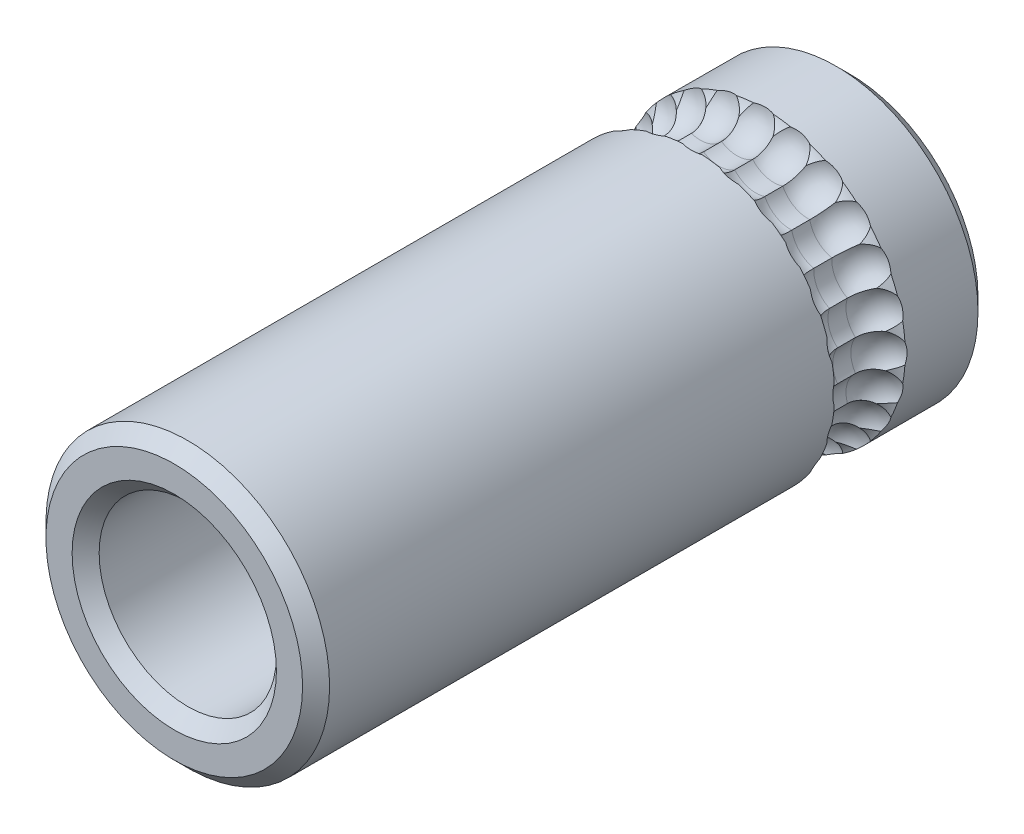
from build123d import *

# Parameters (mm, degrees)
SKETCH1_R           = 4
SKETCH1_R_2         = 2.5
BOSS_EXTRUDE1_DEPTH = 19.05
CIRPATTERN1_COUNT   = 24
CHAMFER1_SIZE       = 0.381
CUT_EXTRUDE1_REACH  = 21.872
SKETCH5_R           = 1.397


with BuildPart() as part:
    # Sketch1 → Boss-Extrude1 (new body)
    with BuildSketch(Plane.XY):
        Circle(SKETCH1_R)
        Circle(SKETCH1_R_2, mode=Mode.SUBTRACT)
    extrude(amount=BOSS_EXTRUDE1_DEPTH)

    # Sketch3 → Cut-Revolve2 (revolve, cut)
    with BuildSketch(Plane(origin=(0, 0, 0), x_dir=(1, 0, 0), z_dir=(0, 1, 0))):
        with BuildLine():
            Line((3.20625, -3.175), (3.20625, -3.683))
            ThreePointArc((3.20625, -3.683), (3.438733992, -4.244266008), (4, -4.47675))
            Line((4, -4.47675), (4, -2.38125))
            ThreePointArc((4, -2.38125), (3.438733992, -2.613733992), (3.20625, -3.175))
        make_face()
    cut_revolve2 = revolve(axis=Axis((4, 0, 3.175), (0, 0, 1)), mode=Mode.SUBTRACT)

    # CirPattern1: Cut-Revolve2 ×24 about axis
    cirpattern1_axis = Axis((0, 0, 19.05), (0, 0, -1))
    for i in range(1, CIRPATTERN1_COUNT):
        add(cut_revolve2.rotate(cirpattern1_axis, i * 360 / CIRPATTERN1_COUNT), mode=Mode.SUBTRACT)

    # Sketch4 → Cut-Revolve3 (revolve, cut)
    with BuildSketch(Plane(origin=(0, 0, 0), x_dir=(1, 0, 0), z_dir=(0, 1, 0))):
        with BuildLine():
            Line((5.07315, -3.175), (5.07315, -3.683))
            ThreePointArc((5.07315, -3.683), (4.2794, -4.47675), (3.48565, -3.683))
            Line((3.48565, -3.683), (3.48565, -3.175))
            ThreePointArc((3.48565, -3.175), (4.2794, -2.38125), (5.07315, -3.175))
        make_face()
    revolve(axis=Axis((0, 0, 19.05), (0, 0, -1)), mode=Mode.SUBTRACT)

    # Chamfer1
    chamfer1_edges = [part.edges().sort_by_distance(p)[0] for p in [
        (-4, 0, 0),
        (-4, 0, 19.05),
        (-2.5, 0, 19.05),
        (-2.5, 0, 0),
    ]]
    chamfer(chamfer1_edges, length=CHAMFER1_SIZE)

    # Sketch5 → Cut-Extrude1 (cut, up to next)
    with BuildSketch(Plane(origin=(0, 0, 0), x_dir=(1, 0, 0), z_dir=(0, 1, 0)), mode=Mode.PRIVATE) as cut_extrude1_sk1:
        with Locations((0, -9.525)):
            Circle(SKETCH5_R)
    cut_extrude1_tool1 = extrude(cut_extrude1_sk1.sketch, amount=-CUT_EXTRUDE1_REACH, mode=Mode.PRIVATE) & part.part
    # Sketch5 → Cut-Extrude1 (cut, up to next)
    with BuildSketch(Plane(origin=(0, 0, 0), x_dir=(1, 0, 0), z_dir=(0, 1, 0)), mode=Mode.PRIVATE) as cut_extrude1_sk2:
        with Locations((0, -14.2875)):
            Circle(SKETCH5_R)
    cut_extrude1_tool2 = extrude(cut_extrude1_sk2.sketch, amount=-CUT_EXTRUDE1_REACH, mode=Mode.PRIVATE) & part.part
    add(cut_extrude1_tool1.solids().sort_by_distance((0, 0, 9.525))[0], mode=Mode.SUBTRACT)
    add(cut_extrude1_tool2.solids().sort_by_distance((0, 0, 14.2875))[0], mode=Mode.SUBTRACT)


solid = part.part
